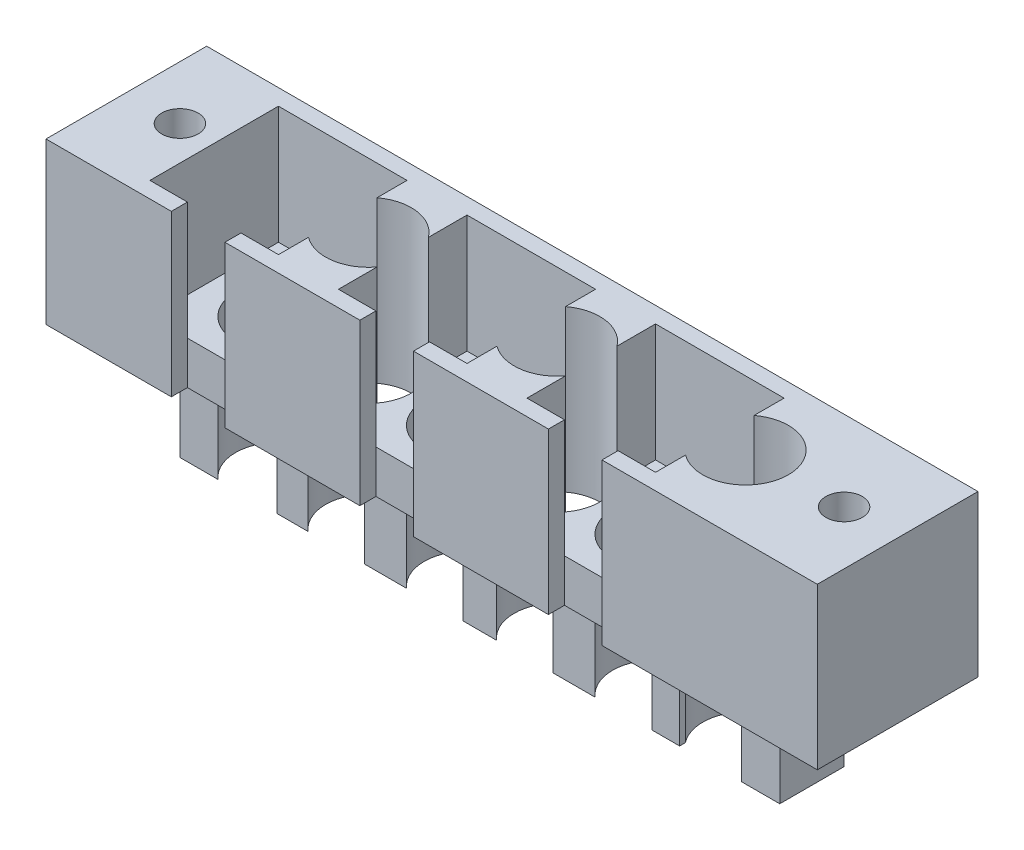
from build123d import *
from build123d.topology import SkipClean

# Parameters (mm, degrees)
SKETCH1_W             = 12
SKETCH1_H             = 12
SKETCH1_R             = 4
BOSS_EXTRUDE1_DEPTH   = 4
BOSS_EXTRUDE1_2_DEPTH = 4
BOSS_EXTRUDE1_3_DEPTH = 4
SKETCH1_3_R           = 1.7
BOSS_EXTRUDE2_DEPTH   = 15
SKETCH4_R             = 4
CUT_EXTRUDE1_DEPTH    = 63.454801186
CUT_EXTRUDE2_DEPTH    = 1
BOSS_EXTRUDE4_DEPTH   = 9


with BuildPart() as part:
    # Sketch1 → Boss-Extrude1 (new body)
    with BuildSketch(Plane(origin=(0, 0, 0), x_dir=(1, 0, 0), z_dir=(0, 1, 0))):
        with Locations((32.734732638, -17.272355561)):
            Rectangle(SKETCH1_W, SKETCH1_H)
        with Locations((32.734732638, -17.272355561)):
            Circle(SKETCH1_R, mode=Mode.SUBTRACT)
    extrude(amount=BOSS_EXTRUDE1_DEPTH)



with BuildPart() as body_2:
    # Sketch1 → Boss-Extrude1 2 (new body)
    with BuildSketch(Plane(origin=(0, 0, 0), x_dir=(1, 0, 0), z_dir=(0, 1, 0))):
        with Locations((15.134732638, -17.272354652)):
            Rectangle(SKETCH1_W, SKETCH1_H)
        with Locations((15.134732638, -17.272354652)):
            Circle(SKETCH1_R, mode=Mode.SUBTRACT)
    extrude(amount=BOSS_EXTRUDE1_2_DEPTH)


with BuildPart() as body_3:
    # Sketch1 → Boss-Extrude1 3 (new body)
    with BuildSketch(Plane(origin=(0, 0, 0), x_dir=(1, 0, 0), z_dir=(0, 1, 0))):
        with Locations((-2.465267362, -17.272354652)):
            Rectangle(SKETCH1_W, SKETCH1_H)
        with Locations((-2.465267362, -17.272354652)):
            Circle(SKETCH1_R, mode=Mode.SUBTRACT)
    extrude(amount=BOSS_EXTRUDE1_3_DEPTH)


with BuildPart() as part_1:
    add(part.part)

    add(body_2.part)  # Boss-Extrude2 merges body 2

    add(body_3.part)  # Boss-Extrude2 merges body 3
    # Sketch1<3> → Boss-Extrude2 (add)
    with BuildSketch(Plane(origin=(0, 0, 0), x_dir=(1, 0, 0), z_dir=(0, 1, 0))):
        Polygon((35.234732638, -24.772354652), (55.334732638, -24.772354652), (55.334732638, -9.772354652), (-16.665267362, -9.772354652), (-16.665267362, -24.772354652), (-4.965267362, -24.772354652), (-4.965267362, -23.272354652), (-8.465267362, -23.272354652), (-8.465267362, -11.272354652), (3.534732638, -11.272354652), (3.534732638, -23.272354652), (0.034732638, -23.272354652), (0.034732638, -24.772354652), (12.634732638, -24.772354652), (12.634732638, -23.272354652), (9.134732638, -23.272354652), (9.134732638, -11.272354652), (21.134732638, -11.272354652), (21.134732638, -23.272354652), (17.634732638, -23.272354652), (17.634732638, -24.772354652), (30.234732638, -24.772354652), (30.234732638, -23.272355561), (26.734732638, -23.272355561), (26.734732638, -11.272355561), (38.734732638, -11.272355561), (38.734732638, -23.272355561), (35.234732638, -23.272355561), align=None)
        with Locations((-11.665267362, -17.272354652)):
            Circle(SKETCH1_3_R, mode=Mode.SUBTRACT)
        with Locations((50.334732638, -17.272354652)):
            Circle(SKETCH1_3_R, mode=Mode.SUBTRACT)
    extrude(amount=BOSS_EXTRUDE2_DEPTH)

    # Sketch4 → Cut-Extrude1 (cut, through all)
    with BuildSketch(Plane(origin=(0, 15, 0), x_dir=(1, 0, 0), z_dir=(0, 1, 0))):
        with Locations((5.934732638, -17.272354652)):
            Circle(SKETCH4_R)
        with Locations((23.534732638, -17.272354652)):
            Circle(SKETCH4_R)
        with Locations((41.134732638, -17.272354652)):
            Circle(SKETCH4_R)
    extrude(amount=-CUT_EXTRUDE1_DEPTH, mode=Mode.SUBTRACT)

    # Sketch3 → Cut-Extrude2 (cut)
    with BuildSketch(Plane.XZ):
        Polygon((-12.75177101, 23.593176671), (-11.204976138, 23.593176671), (-11.204976138, 23.267535646), (-12.466835112, 23.267535646), (-12.466835112, 22.290612569), (-11.204976138, 22.290612569), (-11.204976138, 21.964971543), (-12.466835112, 21.964971543), (-12.466835112, 20.418176671), (-12.75177101, 20.418176671), align=None)
        Polygon((-10.245225537, 23.593176671), (-9.658181266, 23.593176671), (-9.658181266, 20.418176671), (-9.943117163, 20.418176671), (-9.943117163, 23.267535646), (-10.431578702, 23.267535646), align=None)
        with BuildLine():
            Line((-8.070681266, 22.616253594), (-8.355617163, 22.616253594))
            add(Edge.make_bspline(
                [(-8.355617163, 22.616253594), (-8.353760103, 22.654055042), (-8.350112886, 22.728296081), (-8.333032938, 22.83653991), (-8.308593714, 22.940003906), (-8.274039323, 23.037857328), (-8.231125771, 23.130965389), (-8.179663532, 23.21895826), (-8.118709111, 23.301500267), (-8.049578716, 23.377826218), (-7.974495737, 23.447846371), (-7.893482492, 23.508312199), (-7.808351645, 23.559400372), (-7.719361476, 23.602109784), (-7.625507965, 23.634168073), (-7.527642801, 23.657954846), (-7.425336013, 23.672266246), (-7.355631136, 23.673804565), (-7.320180465, 23.674586928)],
                knots=[0, 0, 0, 0, 1.10065271, 2.161652631, 3.183658789, 4.190468796, 5.17591951, 6.163126047, 7.15150782, 8.156236427, 9.156009102, 10.134482811, 11.092018607, 12.041330605, 13.001268258, 13.972401359, 14.968799086, 16, 16, 16, 16], degree=3))
            add(Edge.make_bspline(
                [(-7.320180465, 23.674586928), (-7.285366069, 23.673771899), (-7.216957025, 23.672170398), (-7.117115055, 23.658417178), (-7.02206708, 23.636876534), (-6.931998892, 23.606654693), (-6.847629105, 23.566028819), (-6.768323915, 23.517226766), (-6.693139179, 23.460784491), (-6.625460168, 23.394332817), (-6.563313553, 23.323392082), (-6.509699365, 23.247656627), (-6.463785995, 23.169434346), (-6.425515743, 23.088128764), (-6.397343388, 23.002974331), (-6.375954585, 22.915210797), (-6.363864717, 22.823929718), (-6.362009226, 22.762147343), (-6.361065881, 22.730736767)],
                knots=[0, 0, 0, 0, 1.111607364, 2.184268762, 3.212621178, 4.221274766, 5.211760367, 6.196651075, 7.1921475, 8.207485113, 9.220403448, 10.201281604, 11.166441695, 12.114753415, 13.065576456, 14.026450734, 14.996634279, 16, 16, 16, 16], degree=3))
            add(Edge.make_bspline(
                [(-6.361065881, 22.730736767), (-6.362595909, 22.686513726), (-6.365629115, 22.598843695), (-6.39180536, 22.469844028), (-6.432247691, 22.344744439), (-6.481299653, 22.244070584), (-6.530848311, 22.163355831), (-6.574554268, 22.096303785), (-6.626853188, 22.024796965), (-6.687266556, 21.948115173), (-6.754882994, 21.866023852), (-6.830189157, 21.778489314), (-6.913760319, 21.686441251), (-6.972414527, 21.623570978), (-7.002807668, 21.590993178)],
                knots=[0, 0, 0, 0, 1.184203166, 2.347625244, 3.513805382, 4.700623107, 5.337941753, 6.051866363, 6.845199593, 7.711357327, 8.668078039, 9.695487809, 10.805859518, 12, 12, 12, 12], degree=3))
            Line((-7.002807668, 21.590993178), (-7.797193686, 20.743817697))
            Line((-7.797193686, 20.743817697), (-6.320360753, 20.743817697))
            Line((-6.320360753, 20.743817697), (-6.320360753, 20.418176671))
            Line((-6.320360753, 20.418176671), (-8.477732548, 20.418176671))
            Line((-8.477732548, 20.418176671), (-7.24640242, 21.732189091))
            add(Edge.make_bspline(
                [(-7.24640242, 21.732189091), (-7.216423265, 21.763483983), (-7.158839445, 21.823595067), (-7.077393822, 21.911354752), (-7.004242739, 21.992770407), (-6.938912676, 22.067688205), (-6.882820853, 22.137203984), (-6.8330439, 22.199066322), (-6.793160828, 22.255993574), (-6.749876148, 22.321979702), (-6.707953465, 22.402545161), (-6.671928685, 22.501000722), (-6.649962358, 22.602353301), (-6.647327257, 22.670844435), (-6.646001779, 22.705296062)],
                knots=[0, 0, 0, 0, 1.329631726, 2.553950428, 3.673215718, 4.687767853, 5.603093632, 6.413772471, 7.123043292, 7.734684054, 8.834405432, 9.900288307, 10.943827018, 12, 12, 12, 12], degree=3))
            add(Edge.make_bspline(
                [(-6.646001779, 22.705296062), (-6.646578488, 22.726959902), (-6.647715071, 22.769655171), (-6.657745982, 22.832253252), (-6.672904798, 22.892637048), (-6.694626568, 22.950992295), (-6.723298397, 23.006732279), (-6.758199248, 23.059924851), (-6.798467377, 23.11134984), (-6.845050314, 23.159567475), (-6.896223622, 23.203728283), (-6.95028412, 23.242847989), (-7.007479571, 23.275540611), (-7.067568825, 23.302340783), (-7.130384358, 23.323364165), (-7.196047662, 23.337931591), (-7.264377306, 23.347077844), (-7.311034834, 23.348315343), (-7.33480887, 23.348945902)],
                knots=[0, 0, 0, 0, 0.991446411, 1.95395049, 2.89581595, 3.838931463, 4.798493298, 5.75982156, 6.748411868, 7.785213223, 8.824556874, 9.840280684, 10.836137867, 11.835679398, 12.848801643, 13.863922112, 14.911575587, 16, 16, 16, 16], degree=3))
            add(Edge.make_bspline(
                [(-7.33480887, 23.348945902), (-7.359638126, 23.348297266), (-7.408398684, 23.347023451), (-7.479989521, 23.338112891), (-7.548284476, 23.322740593), (-7.613455345, 23.301716039), (-7.675612398, 23.274992926), (-7.734453352, 23.241708272), (-7.789846116, 23.201990389), (-7.841894819, 23.156959313), (-7.88985, 23.106823704), (-7.931983952, 23.050934666), (-7.96879945, 22.990312653), (-8.000920684, 22.925121239), (-8.027006203, 22.854768882), (-8.046938989, 22.779505321), (-8.062711343, 22.699657354), (-8.067980501, 22.644516598), (-8.070681266, 22.616253594)],
                knots=[0, 0, 0, 0, 1.031018746, 2.02475058, 2.990194455, 3.934040569, 4.864654155, 5.795059489, 6.735614925, 7.690564532, 8.649604399, 9.611025574, 10.590972636, 11.591080095, 12.624614302, 13.701020113, 14.821632451, 16, 16, 16, 16], degree=3))
        make_face()
    extrude(amount=-CUT_EXTRUDE2_DEPTH, mode=Mode.SUBTRACT)

    # Sketch5 → Boss-Extrude4 (add)
    with SkipClean():  # the faces are left unmerged after this step: merging them gives an invalid solid
        with BuildSketch(Plane.XZ):
            with BuildLine():
                ThreePointArc((0.406157251, 20.057120476), (1.534732638, 17.272354652), (0.406157251, 14.487588828))
                Line((0.406157251, 14.487588828), (0.406157251, 14.272354652))
                Line((0.406157251, 14.272354652), (3.288981327, 14.272354652))
                ThreePointArc((3.288981327, 14.272354652), (1.934732638, 17.272354652), (3.288981327, 20.272354652))
                Line((3.288981327, 20.272354652), (0.406157251, 20.272354652))
                Line((0.406157251, 20.272354652), (0.406157251, 20.057120476))
            make_face()
            with BuildLine():
                Line((-8.668139711, 14.272354652), (-5.111018673, 14.272354652))
                ThreePointArc((-5.111018673, 14.272354652), (-6.465267362, 17.272354652), (-5.111018673, 20.272354652))
                Line((-5.111018673, 20.272354652), (-8.668139711, 20.272354652))
                Line((-8.668139711, 20.272354652), (-8.668139711, 14.272354652))
            make_face()
            with BuildLine():
                ThreePointArc((8.580483949, 20.272354652), (9.934732638, 17.272354652), (8.580483949, 14.272354652))
                Line((8.580483949, 14.272354652), (12.488981327, 14.272354652))
                ThreePointArc((12.488981327, 14.272354652), (11.134732638, 17.272354652), (12.488981327, 20.272354652))
                Line((12.488981327, 20.272354652), (8.580483949, 20.272354652))
            make_face()
            with BuildLine():
                ThreePointArc((17.780483949, 20.272354652), (19.134732638, 17.272354652), (17.780483949, 14.272354652))
                Line((17.780483949, 14.272354652), (20.888981327, 14.272354652))
                ThreePointArc((20.888981327, 14.272354652), (19.534732638, 17.272354652), (20.888981327, 20.272354652))
                Line((20.888981327, 20.272354652), (17.780483949, 20.272354652))
            make_face()
            with BuildLine():
                ThreePointArc((26.180483949, 20.272354652), (27.534732638, 17.272354652), (26.180483949, 14.272354652))
                Line((26.180483949, 14.272354652), (30.088982357, 14.272354652))
                ThreePointArc((30.088982357, 14.272354652), (28.734732638, 17.272354187), (30.088980297, 20.272354652))
                Line((30.088980297, 20.272354652), (26.180483949, 20.272354652))
            make_face()
            with BuildLine():
                ThreePointArc((35.380484979, 20.272354652), (36.734732638, 17.272354187), (35.380482919, 14.272354652))
                Line((35.380482919, 14.272354652), (37.980901679, 14.272354652))
                Line((37.980901679, 14.272354652), (37.980901679, 14.81199893))
                ThreePointArc((37.980901679, 14.81199893), (37.134732638, 17.272354652), (37.980901679, 19.732710374))
                Line((37.980901679, 19.732710374), (37.980901679, 20.272354652))
                Line((37.980901679, 20.272354652), (35.380484979, 20.272354652))
            make_face()
            with BuildLine():
                ThreePointArc((43.780483949, 20.272354652), (45.134732638, 17.272354652), (43.780483949, 14.272354652))
                Line((43.780483949, 14.272354652), (47.330399458, 14.272354652))
                Line((47.330399458, 14.272354652), (47.330399458, 20.272354652))
                Line((47.330399458, 20.272354652), (43.780483949, 20.272354652))
            make_face()
        extrude(amount=BOSS_EXTRUDE4_DEPTH)


solid = part_1.part
